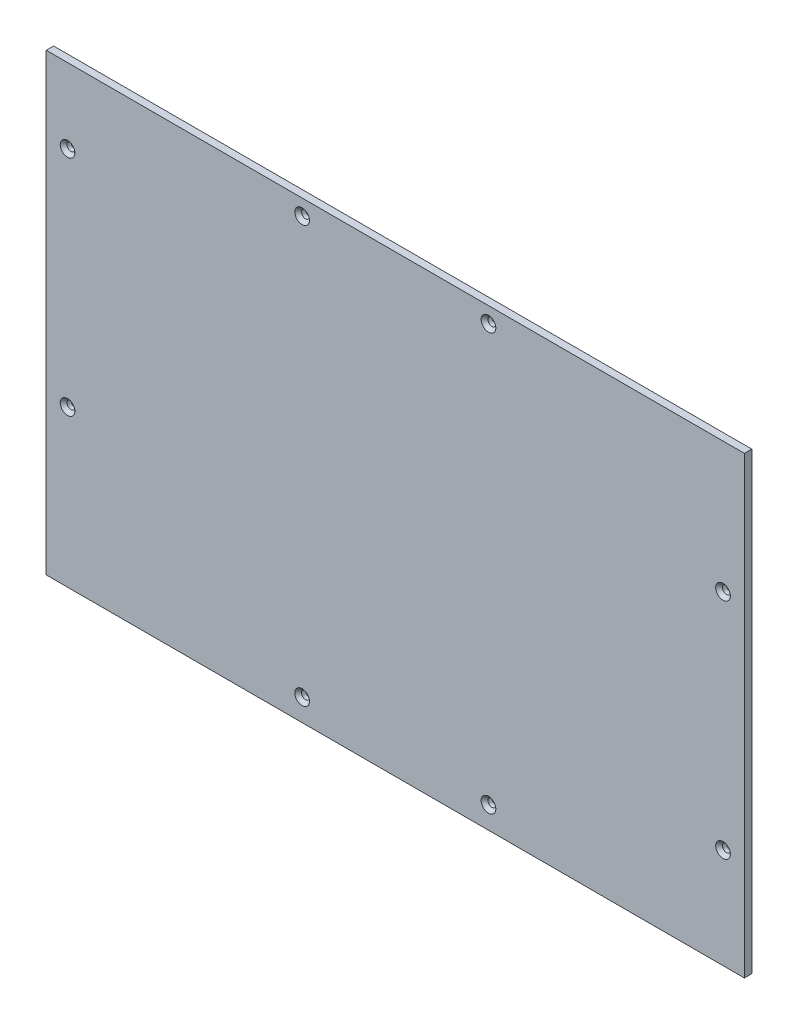
from build123d import *

# Parameters (mm, degrees)
SKETCH1_W                                       = 299.7
SKETCH1_H                                       = 195.04375
BOSS_EXTRUDE1_DEPTH                             = 3.175
CSK_FOR_M3_FLAT_HEAD_MACHINE_SCREW1_D           = 3.4
CSK_FOR_M3_FLAT_HEAD_MACHINE_SCREW1_CSINK_D     = 6.3
CSK_FOR_M3_FLAT_HEAD_MACHINE_SCREW1_CSINK_ANGLE = 90


with BuildPart() as part:
    # Sketch1 → Boss-Extrude1 (new body)
    with BuildSketch(Plane.XY):
        Rectangle(SKETCH1_W, SKETCH1_H)
    extrude(amount=BOSS_EXTRUDE1_DEPTH)

    # CSK for M3 Flat Head Machine Screw1 (through all)
    with Locations(Plane.XY.offset(3.175)):
        with Locations((-40, 90.775000052), (140.687500033, 41.475000052), (140.687500033, -54.524999948), (40, -88.030749948), (-40, -88.030749948), (-140.687500033, -30.524999948), (-140.687500033, 65.475000052), (40, 90.775000052)):
            CounterSinkHole(CSK_FOR_M3_FLAT_HEAD_MACHINE_SCREW1_D / 2, CSK_FOR_M3_FLAT_HEAD_MACHINE_SCREW1_CSINK_D / 2, counter_sink_angle=CSK_FOR_M3_FLAT_HEAD_MACHINE_SCREW1_CSINK_ANGLE)


solid = part.part
